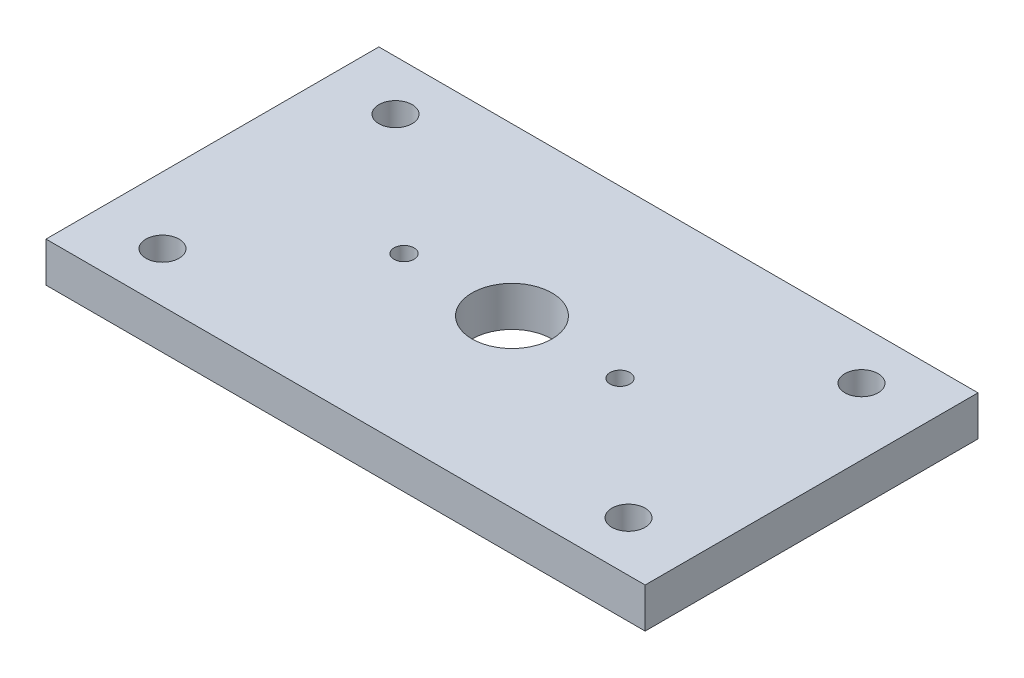
from build123d import *

# Parameters (mm, degrees)
SKETCH1_W           = 90
SKETCH1_H           = 50
SKETCH1_R           = 6
SKETCH1_R_2         = 1.5
SKETCH1_R_3         = 2.5
BOSS_EXTRUDE1_DEPTH = 6


with BuildPart() as part:
    # Sketch1 → Boss-Extrude1 (new body)
    with BuildSketch(Plane(origin=(0, 0, 0), x_dir=(1, 0, 0), z_dir=(0, 1, 0))):
        Rectangle(SKETCH1_W, SKETCH1_H)
        Circle(SKETCH1_R, mode=Mode.SUBTRACT)
        with Locations((-16.22, 0)):
            Circle(SKETCH1_R_2, mode=Mode.SUBTRACT)
        with Locations((16.22, 0)):
            Circle(SKETCH1_R_2, mode=Mode.SUBTRACT)
        with Locations((-35, 17.5)):
            Circle(SKETCH1_R_3, mode=Mode.SUBTRACT)
        with Locations((35, 17.5)):
            Circle(SKETCH1_R_3, mode=Mode.SUBTRACT)
        with Locations((35, -17.5)):
            Circle(SKETCH1_R_3, mode=Mode.SUBTRACT)
        with Locations((-35, -17.5)):
            Circle(SKETCH1_R_3, mode=Mode.SUBTRACT)
    extrude(amount=BOSS_EXTRUDE1_DEPTH)


solid = part.part
